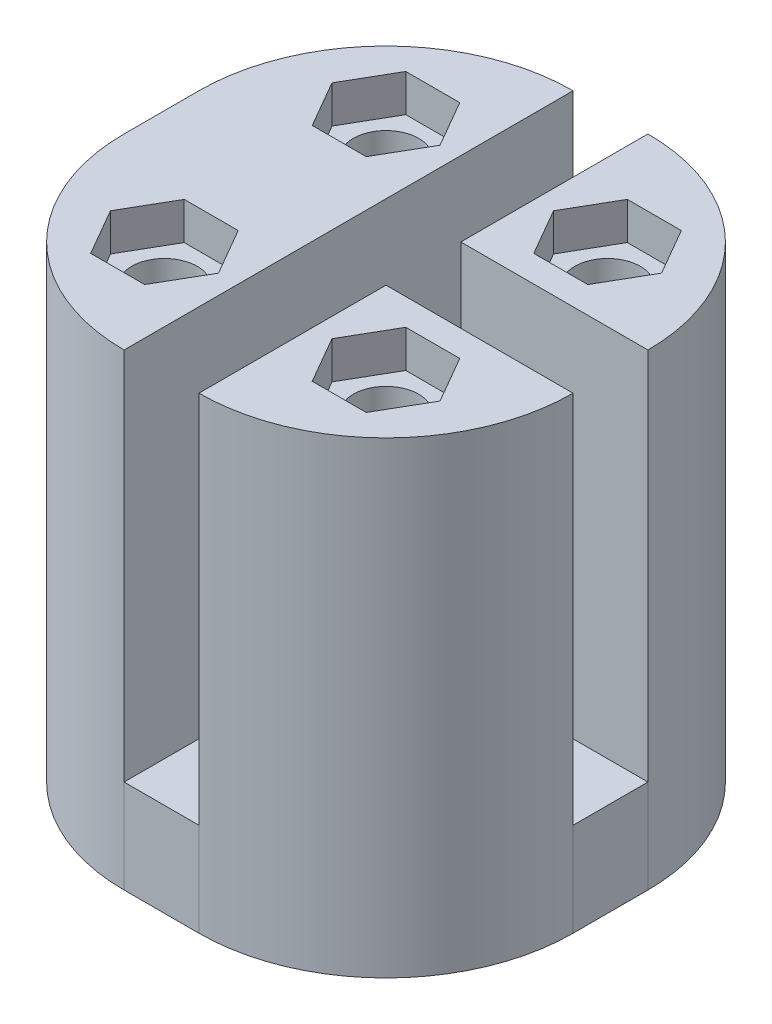
from build123d import *

# Parameters (mm, degrees)
SKETCH1_W               = 10
SKETCH1_H               = 24
BOSS_EXTRUDE1_DEPTH     = 20
BOSS_EXTRUDE1_2_DEPTH   = 20
BOSS_EXTRUDE1_3_DEPTH   = 20
BOSS_EXTRUDE2_DEPTH     = 5
FILLET1_R               = 10
SKETCH3_R               = 1.75
CUT_EXTRUDE1_DEPTH      = 29
MIRROR2_COPY_1_SKETCH_R = 1.75
MIRROR2_COPY_1_DEPTH    = 29
CUT_EXTRUDE2_DEPTH      = 2


with BuildPart() as part:
    # Sketch1 → Boss-Extrude1 (new body)
    with BuildSketch(Plane(origin=(0, 0, 0), x_dir=(1, 0, 0), z_dir=(0, 1, 0))):
        with Locations((-5, 3.136015275)):
            Rectangle(SKETCH1_W, SKETCH1_H)
    extrude(amount=BOSS_EXTRUDE1_DEPTH)



with BuildPart() as body_2:
    # Sketch1 → Boss-Extrude1 2 (new body)
    with BuildSketch(Plane(origin=(0, 0, 0), x_dir=(1, 0, 0), z_dir=(0, 1, 0))):
        with BuildLine():
            ThreePointArc((14, 1.136015275), (11.071067812, -5.935052537), (4, -8.863984725))
            Line((4, -8.863984725), (4, 1.136015275))
            Line((4, 1.136015275), (14, 1.136015275))
        make_face()
    extrude(amount=BOSS_EXTRUDE1_2_DEPTH)


with BuildPart() as body_3:
    # Sketch1 → Boss-Extrude1 3 (new body)
    with BuildSketch(Plane(origin=(0, 0, 0), x_dir=(1, 0, 0), z_dir=(0, 1, 0))):
        with BuildLine():
            ThreePointArc((4, 15.136015275), (11.071067812, 12.207083087), (14, 5.136015275))
            Line((14, 5.136015275), (4, 5.136015275))
            Line((4, 5.136015275), (4, 15.136015275))
        make_face()
    extrude(amount=BOSS_EXTRUDE1_3_DEPTH)


with BuildPart() as part_1:
    add(part.part)

    add(body_2.part)  # Boss-Extrude2 merges body 2

    add(body_3.part)  # Boss-Extrude2 merges body 3
    # Sketch2 → Boss-Extrude2 (add)
    with BuildSketch(Plane.XZ):
        with BuildLine():
            Line((-10, 8.863984725), (-10, -15.136015275))
            Line((-10, -15.136015275), (0, -15.136015275))
            Line((0, -15.136015275), (4, -15.136015275))
            ThreePointArc((4, -15.136015275), (11.071067812, -12.207083087), (14, -5.136015275))
            Line((14, -5.136015275), (14, -1.136015275))
            ThreePointArc((14, -1.136015275), (11.071067812, 5.935052537), (4, 8.863984725))
            Line((4, 8.863984725), (0, 8.863984725))
            Line((0, 8.863984725), (-10, 8.863984725))
        make_face()
    extrude(amount=BOSS_EXTRUDE2_DEPTH)

    # Fillet1
    fillet1_edges = [part_1.edges().sort_by_distance(p)[0] for p in [
        (-10, 7.5, 8.863984725),
        (-10, 7.5, -15.136015275),
    ]]
    fillet(fillet1_edges, radius=FILLET1_R - 0.0001)  # a hair under: the kernel refuses the full size

    # Sketch3 → Cut-Extrude1 (cut)
    with BuildSketch(Plane(origin=(0, 20, 0), x_dir=(1, 0, 0), z_dir=(0, 1, 0))):
        with Locations(Location((7.920878707, 9.056893982, 0), (0, 0, 270))):
            Circle(SKETCH3_R)
    cut_extrude1 = extrude(amount=-CUT_EXTRUDE1_DEPTH, mode=Mode.SUBTRACT)

    # Mirror1: Cut-Extrude1 across plane
    add(cut_extrude1.mirror(Plane.XY.offset(-3.136015275)), mode=Mode.SUBTRACT)

    # Mirror2: Cut-Extrude1 across plane
    add(cut_extrude1.mirror(Plane(origin=(2, 0, 0), x_dir=(0, 0, 1), z_dir=(1, 0, 0))), mode=Mode.SUBTRACT)

    # Mirror2 copy 1 sketch → Mirror2 copy 1 (cut)
    with BuildSketch(Plane(origin=(4, 20, -6.27203055), x_dir=(-1, 0, 0), z_dir=(0, 1, 0))):
        with Locations(Location((7.920878707, 9.056893982, 0), (0, 0, 270))):
            Circle(MIRROR2_COPY_1_SKETCH_R)
    extrude(amount=-MIRROR2_COPY_1_DEPTH, mode=Mode.SUBTRACT)

    # Sketch4 → Cut-Extrude2 (cut)
    with BuildSketch(Plane(origin=(0, 20, 0), x_dir=(1, 0, 0), z_dir=(0, 1, 0))):
        Polygon((10.807630053, 9.056893982), (9.36425438, 11.556893982), (6.477503035, 11.556893982), (5.034127362, 9.056893982), (6.477503035, 6.556893982), (9.36425438, 6.556893982), align=None)
        Polygon((10.807630053, -2.784863433), (9.36425438, -0.284863433), (6.477503035, -0.284863433), (5.034127362, -2.784863433), (6.477503035, -5.284863433), (9.36425438, -5.284863433), align=None)
        Polygon((-6.807630053, -2.784863433), (-5.36425438, -5.284863433), (-2.477503035, -5.284863433), (-1.034127362, -2.784863433), (-2.477503035, -0.284863433), (-5.36425438, -0.284863433), align=None)
        Polygon((-6.807630053, 9.056893982), (-5.36425438, 6.556893982), (-2.477503035, 6.556893982), (-1.034127362, 9.056893982), (-2.477503035, 11.556893982), (-5.36425438, 11.556893982), align=None)
    extrude(amount=-CUT_EXTRUDE2_DEPTH, mode=Mode.SUBTRACT)


solid = part_1.part
